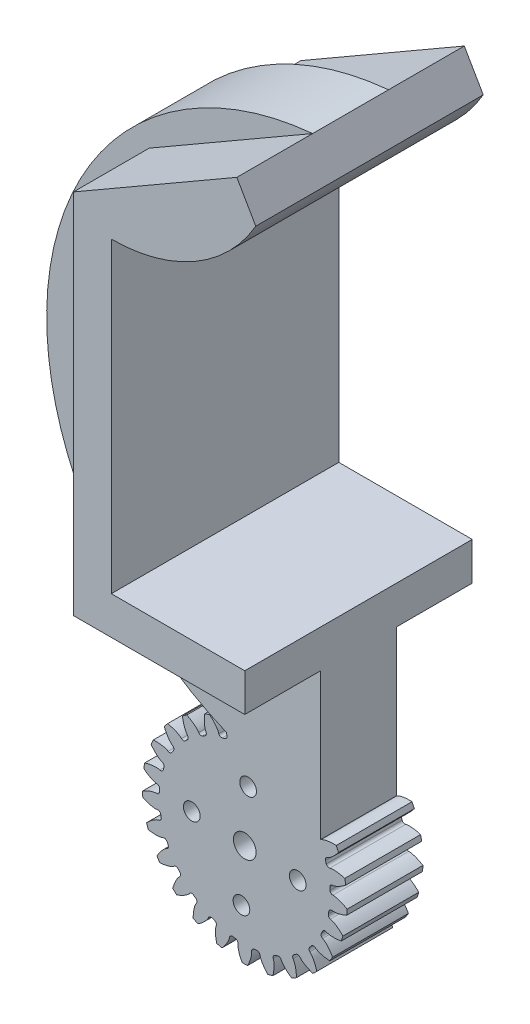
from build123d import *

# Parameters (mm, degrees)
SKETCH_1_R           = 13.5
LASHENA_DEPTH        = 10
CUT_EXTRUDEA_DEPTH   = 30
WWW_KYTOOL_CN_COUNT  = 25
EXTRUDE_2_DEPTH      = 10
EXTRUDE_2_DEPTH_BACK = 20
CUT_EXTRUDE_START    = -10
CUT_EXTRUDE_2_DEPTH  = 10
EXTRUDE_3_DEPTH      = 10
CUT_EXTRUDE_3_DEPTH  = 10
SKETCH_7_R           = 1.5
SKETCH_7_R_2         = 1.1
CUT_EXTRUDE_4_DEPTH  = 92.919458353
CUT_EXTRUDE_5_DEPTH  = 10


with BuildPart() as part:
    # 草图1 → LaShenA (new body)
    with BuildSketch(Plane.XY):
        Circle(SKETCH_1_R)
    extrude(amount=LASHENA_DEPTH)

    # SketchA → Cut-ExtrudeA (cut)
    with BuildSketch(Plane.XY.offset(10)):
        with BuildLine():
            ThreePointArc((0.168413676, 11.248739344), (0, 11.25), (-0.168413676, 11.248739344))
            ThreePointArc((-0.168413676, 11.248739344), (-0.431955465, 11.349569992), (-0.553318931, 11.60430908))
            add(Edge.make_bspline(
                [(-0.553318931, 11.60430908), (-0.556083603, 11.647298384), (-0.561050641, 11.7223845), (-0.572489313, 11.811624088), (-0.58477152, 11.87427273), (-0.59566003, 11.923918216), (-0.609744808, 11.980847357), (-0.62734241, 12.044939707), (-0.64885177, 12.116041497), (-0.674637893, 12.193990315), (-0.705068872, 12.278607345), (-0.740503482, 12.369700094), (-0.781294405, 12.467061823), (-0.827786595, 12.570472023), (-0.880317153, 12.679696595), (-0.939214753, 12.794488133), (-1.004799208, 12.914586205), (-1.077381014, 13.039717642), (-1.157260907, 13.169596858), (-1.244729425, 13.303926167), (-1.340066518, 13.442396124), (-1.443541, 13.584685884), (-1.595874213, 13.783191625), (-1.71844413, 13.930490189), (-1.804245931, 14.028565279)],
                knots=[0.117691322, 0.117691322, 0.117691322, 0.117691322, 0.158671831, 0.189773021, 0.203463493, 0.219643142, 0.238311966, 0.259469968, 0.283117146, 0.3092535, 0.337879031, 0.368993739, 0.402597623, 0.438690683, 0.47727292, 0.518344334, 0.561904924, 0.60795469, 0.656493633, 0.707521753, 0.761039049, 0.817045522, 0.875541172, 1, 1, 1, 1], degree=3))
            ThreePointArc((-1.804245931, 14.028565279), (0, 14.144113516), (1.804245931, 14.028565279))
            add(Edge.make_bspline(
                [(0.553318931, 11.60430908), (0.556083603, 11.647298384), (0.561050641, 11.7223845), (0.572489313, 11.811624088), (0.58477152, 11.87427273), (0.59566003, 11.923918216), (0.609744808, 11.980847357), (0.62734241, 12.044939707), (0.64885177, 12.116041497), (0.674637893, 12.193990315), (0.705068872, 12.278607345), (0.740503482, 12.369700094), (0.781294405, 12.467061823), (0.827786595, 12.570472023), (0.880317153, 12.679696595), (0.939214753, 12.794488133), (1.004799208, 12.914586205), (1.077381014, 13.039717642), (1.157260907, 13.169596858), (1.244729425, 13.303926167), (1.340066518, 13.442396124), (1.443541, 13.584685884), (1.595874213, 13.783191625), (1.71844413, 13.930490189), (1.804245931, 14.028565279)],
                knots=[0.117691322, 0.117691322, 0.117691322, 0.117691322, 0.158671831, 0.189773021, 0.203463493, 0.219643142, 0.238311966, 0.259469968, 0.283117146, 0.3092535, 0.337879031, 0.368993739, 0.402597623, 0.438690683, 0.47727292, 0.518344334, 0.561904924, 0.60795469, 0.656493633, 0.707521753, 0.761039049, 0.817045522, 0.875541172, 1, 1, 1, 1], degree=3))
            ThreePointArc((0.553318931, 11.60430908), (0.431955465, 11.349569992), (0.168413676, 11.248739344))
        make_face()
    cut_extrudea = extrude(amount=-CUT_EXTRUDEA_DEPTH, mode=Mode.SUBTRACT)

    # www.KYTool.cn: Cut-ExtrudeA ×25 about axis
    www_kytool_cn_axis = Axis((0, 0, -88.99), (0, 0, 1))
    for i in range(1, WWW_KYTOOL_CN_COUNT):
        add(cut_extrudea.rotate(www_kytool_cn_axis, i * 360 / WWW_KYTOOL_CN_COUNT), mode=Mode.SUBTRACT)

    # 草图3 → 凸台-拉伸2 (add, two sides: drawn at the far end of the back side and taken through both)
    with BuildSketch(Plane.XY.offset(10).offset(-EXTRUDE_2_DEPTH_BACK)):
        with BuildLine():
            Line((10, 0), (10, 30))
            Line((10, 30), (-7.6, 30))
            Line((-7.6, 30), (-7.6, 70.5))
            ThreePointArc((-7.6, 70.5), (3.4, 73.447441117), (11.452558883, 81.5))
            Line((11.452558883, 81.5), (8.952558883, 85.830127019))
            Line((8.952558883, 85.830127019), (-12.6, 73.386751346))
            Line((-12.6, 73.386751346), (-12.6, 25))
            Line((-12.6, 25), (5, 25))
            Line((5, 25), (5, 8.660254038))
            ThreePointArc((5, 8.660254038), (8.660254038, 5), (10, 0))
        make_face()
    extrude(amount=EXTRUDE_2_DEPTH + EXTRUDE_2_DEPTH_BACK)

    # 草图4 → 切除-拉伸2 (cut)
    with BuildSketch(Plane.XY.offset(20).offset(CUT_EXTRUDE_START)):
        with BuildLine():
            Line((10, 0), (10, 25))
            Line((10, 25), (5, 25))
            Line((5, 25), (5, 8.660254038))
            ThreePointArc((5, 8.660254038), (8.660254038, 5), (10, 0))
        make_face()
    extrude(amount=CUT_EXTRUDE_2_DEPTH, mode=Mode.SUBTRACT)

    # 草图5 → 凸台-拉伸3 (add)
    with BuildSketch(Plane.XY.offset(10)):
        with BuildLine():
            Line((-12.6, 73.386751346), (8.952558883, 85.830127019))
            ThreePointArc((8.952558883, 85.830127019), (-26.070673684, 49.367920559), (5, 9.483931839))
            Line((5, 9.483931839), (5, 25))
            Line((5, 25), (-12.6, 25))
            Line((-12.6, 25), (-12.6, 73.386751346))
        make_face()
    extrude(amount=-EXTRUDE_3_DEPTH)

    # 草图6 → 切除-拉伸3 (cut)
    with BuildSketch(Plane(origin=(0, 0, -10), x_dir=(-1, 0, 0), z_dir=(0, 0, -1))):
        with BuildLine():
            Line((-5, 25), (-5, 8.660254038))
            ThreePointArc((-5, 8.660254038), (-8.049998244, 4.647668653), (-10, 0))
            Line((-10, 0), (-10, 25))
            Line((-10, 25), (-5, 25))
        make_face()
    extrude(amount=-CUT_EXTRUDE_3_DEPTH, mode=Mode.SUBTRACT)

    # 草图7 → 切除-拉伸4 (cut, through all)
    with BuildSketch(Plane.XY.offset(10)):
        Circle(SKETCH_7_R)
        with Locations((-6.986187099, 0.439533637)):
            Circle(SKETCH_7_R_2)
        with Locations((0.439533637, 6.986187099)):
            Circle(SKETCH_7_R_2)
        with Locations((6.986187099, -0.439533637)):
            Circle(SKETCH_7_R_2)
        with Locations((-0.439533637, -6.986187099)):
            Circle(SKETCH_7_R_2)
    extrude(amount=-CUT_EXTRUDE_4_DEPTH, mode=Mode.SUBTRACT)

    # 草图8 → 切除-拉伸5 (cut)
    with BuildSketch(Plane.XY.offset(10).offset(CUT_EXTRUDE_START)):
        with BuildLine():
            Line((10, 8.841974958), (10, 7.189321151))
            add(Edge.make_bspline(
                [(10.627276181, 8.325322874), (10.586508095, 8.226381289), (10.522864485, 8.081892325), (10.43250813, 7.896692988), (10.365747439, 7.768361366), (10.299487193, 7.648634814), (10.234124403, 7.537397543), (10.170050328, 7.434519074), (10.107649969, 7.339854463), (10.051270044, 7.258939886), (10.015352802, 7.209852679), (10, 7.189321151)],
                knots=[0.358992653, 0.358992653, 0.358992653, 0.358992653, 0.461197689, 0.509736632, 0.555786399, 0.599346989, 0.640418402, 0.679000639, 0.7150937, 0.748697584, 0.773183044, 0.773183044, 0.773183044, 0.773183044], degree=3))
            ThreePointArc((10.627276181, 8.325322874), (10.401928777, 8.605223862), (10.169211499, 8.879027958))
            ThreePointArc((10.169211499, 8.879027958), (10.084482274, 8.861065339), (10, 8.841974958))
        make_face()
    extrude(amount=CUT_EXTRUDE_5_DEPTH, mode=Mode.SUBTRACT)


solid = part.part
